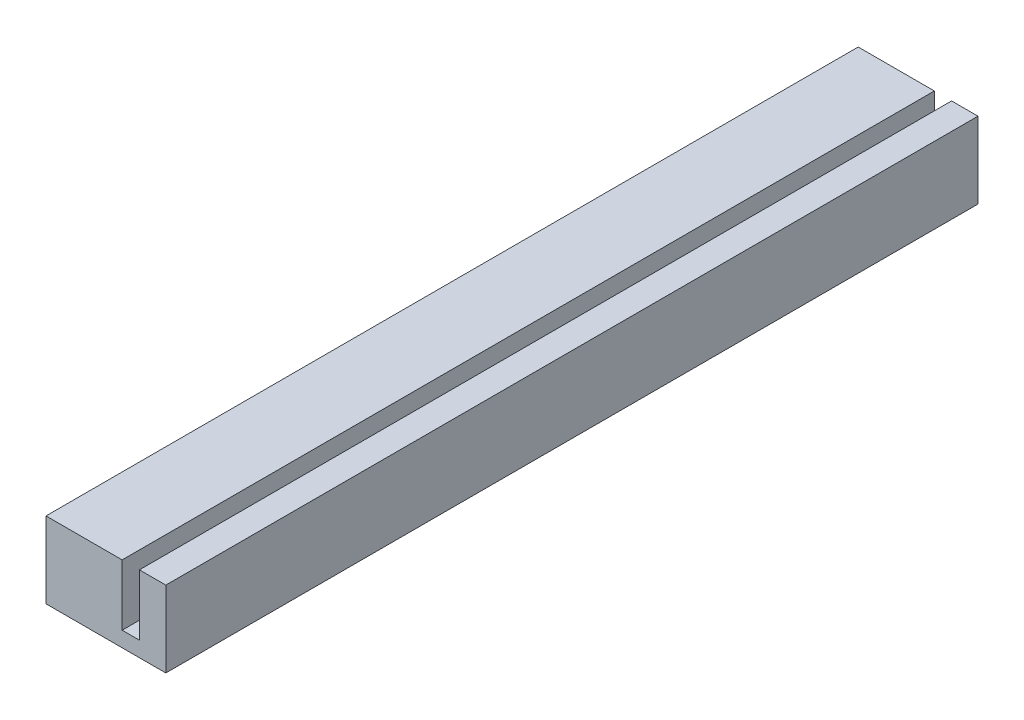
from build123d import *

# Parameters (mm, degrees)
SKETCH1_W           = 11.8
SKETCH1_H           = 80
BOSS_EXTRUDE1_DEPTH = 1.5
SKETCH2_W           = 7.5
SKETCH2_H           = 80
SKETCH2_W_2         = 2.6
BOSS_EXTRUDE2_DEPTH = 6


with BuildPart() as part:
    # Sketch1 → Boss-Extrude1 (new body)
    with BuildSketch(Plane(origin=(0, 0, 0), x_dir=(1, 0, 0), z_dir=(0, 1, 0))):
        with Locations((2.138034865, -38.013787639)):
            Rectangle(SKETCH1_W, SKETCH1_H)
    extrude(amount=BOSS_EXTRUDE1_DEPTH)

    # Sketch2 → Boss-Extrude2 (add)
    with BuildSketch(Plane(origin=(0, 1.5, 0), x_dir=(1, 0, 0), z_dir=(0, 1, 0))):
        with Locations((-0.011965135, -38.013787639)):
            Rectangle(SKETCH2_W, SKETCH2_H)
        with Locations((6.738034865, -38.013787639)):
            Rectangle(SKETCH2_W_2, SKETCH2_H)
    extrude(amount=BOSS_EXTRUDE2_DEPTH)


solid = part.part
